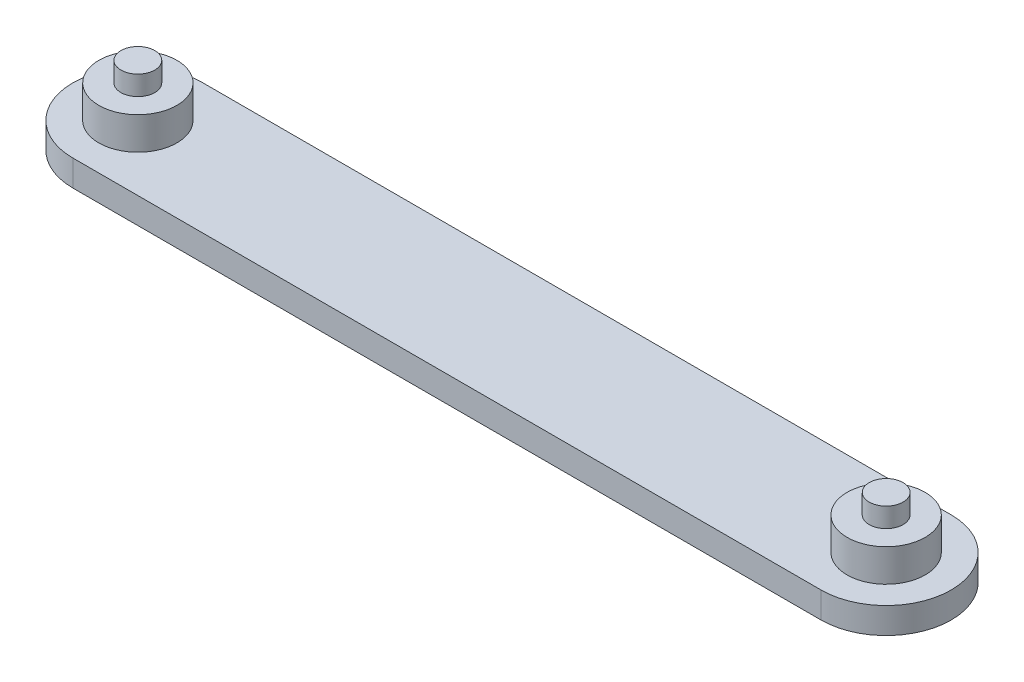
from build123d import *

# Parameters (mm, degrees)
SKETCH1_W           = 67.5
SKETCH1_H           = 10
BOSS_EXTRUDE4_DEPTH = 2
SKETCH4_R           = 3.5
BOSS_EXTRUDE6_DEPTH = 2.5
CUT_EXTRUDE2_DEPTH  = 2.5
CUT_EXTRUDE3_START  = -2.5
SKETCH7_R           = 3.5
SKETCH7_R_2         = 3
CUT_EXTRUDE3_DEPTH  = 2.5
SKETCH8_R           = 1.3
BOSS_EXTRUDE7_DEPTH = 1.5


with BuildPart() as part:
    # Sketch1 → Boss-Extrude4 (new body)
    with BuildSketch(Plane(origin=(0, 0, 0), x_dir=(1, 0, 0), z_dir=(0, 1, 0))):
        with Locations((33.75, 5)):
            Rectangle(SKETCH1_W, SKETCH1_H)
    extrude(amount=BOSS_EXTRUDE4_DEPTH)

    # Sketch4 → Boss-Extrude6 (add)
    with BuildSketch(Plane(origin=(0, 2, 0), x_dir=(1, 0, 0), z_dir=(0, 1, 0))):
        with Locations((5, 5)):
            Circle(SKETCH4_R)
        with Locations((62.5, 5)):
            Circle(SKETCH4_R)
    extrude(amount=BOSS_EXTRUDE6_DEPTH)

    # Sketch5 → Cut-Extrude2 (cut)
    with BuildSketch(Plane(origin=(0, 2, 0), x_dir=(1, 0, 0), z_dir=(0, 1, 0))):
        with BuildLine():
            Line((67.5, 10), (62.5, 10))
            ThreePointArc((62.5, 10), (66.035533906, 8.535533906), (67.5, 5))
            Line((67.5, 5), (67.5, 10))
        make_face()
        with BuildLine():
            Line((67.5, 0), (67.5, 5))
            ThreePointArc((67.5, 5), (66.035533906, 1.464466094), (62.5, 0))
            Line((62.5, 0), (67.5, 0))
        make_face()
        with BuildLine():
            ThreePointArc((0, 5), (1.464466094, 8.535533906), (5, 10))
            Line((5, 10), (0, 10))
            Line((0, 10), (0, 5))
        make_face()
        with BuildLine():
            ThreePointArc((5, 0), (1.464466094, 1.464466094), (0, 5))
            Line((0, 5), (0, 0))
            Line((0, 0), (5, 0))
        make_face()
    extrude(amount=-CUT_EXTRUDE2_DEPTH, mode=Mode.SUBTRACT)

    # Sketch7 → Cut-Extrude3 (cut)
    # profile 1 of 2: a face of its own
    with BuildSketch(Plane(origin=(0, 4.5, 0), x_dir=(1, 0, 0), z_dir=(0, 1, 0)).offset(CUT_EXTRUDE3_START)):
        with Locations((5, 5)):
            Circle(SKETCH7_R)
        with Locations((5, 5)):
            Circle(SKETCH7_R_2, mode=Mode.SUBTRACT)
    # profile 2 of 2: a face of its own
    with BuildSketch(Plane(origin=(0, 4.5, 0), x_dir=(1, 0, 0), z_dir=(0, 1, 0)).offset(CUT_EXTRUDE3_START)):
        with Locations((62.5, 5)):
            Circle(SKETCH7_R)
        with Locations((62.5, 5)):
            Circle(SKETCH7_R_2, mode=Mode.SUBTRACT)
    extrude(amount=CUT_EXTRUDE3_DEPTH, mode=Mode.SUBTRACT)

    # Sketch8 → Boss-Extrude7 (add)
    with BuildSketch(Plane(origin=(0, 4.5, 0), x_dir=(1, 0, 0), z_dir=(0, 1, 0))):
        with Locations((5, 5)):
            Circle(SKETCH8_R)
        with Locations((62.5, 5)):
            Circle(SKETCH8_R)
    extrude(amount=BOSS_EXTRUDE7_DEPTH)


solid = part.part
